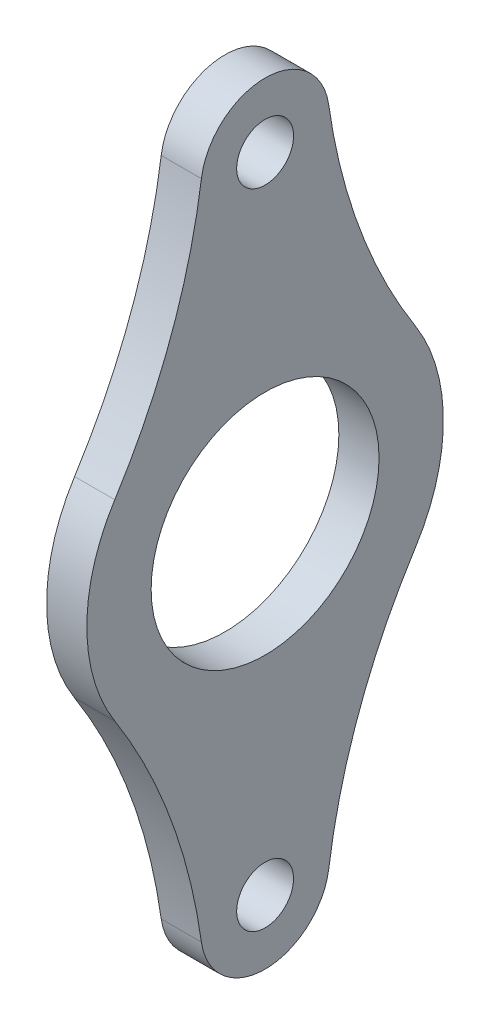
from build123d import *

# Parameters (mm, degrees)
SKETCH1_R           = 2.2479
SKETCH1_R_2         = 9.000000034
BOSS_EXTRUDE1_DEPTH = 3.175


with BuildPart() as part:
    # Sketch1 → Boss-Extrude1 (new body)
    with BuildSketch(Plane.ZY.offset(-54.188)):
        with BuildLine():
            ThreePointArc((-11.872772186, 7.568598389), (-14.080000034, 0), (-11.872772186, -7.568598389))
            ThreePointArc((-11.872772186, -7.568598389), (-7.456309271, -16.470429165), (-5.030561789, -26.106999353))
            ThreePointArc((-5.030561789, -26.106999353), (0, -30.48), (5.030561789, -26.106999353))
            ThreePointArc((5.030561789, -26.106999353), (7.456309271, -16.470429165), (11.872772186, -7.568598389))
            ThreePointArc((11.872772186, -7.568598389), (14.080000034, 0), (11.872772186, 7.568598389))
            ThreePointArc((11.872772186, 7.568598389), (7.456309271, 16.470429165), (5.030561789, 26.106999353))
            ThreePointArc((5.030561789, 26.106999353), (0, 30.48), (-5.030561789, 26.106999353))
            ThreePointArc((-5.030561789, 26.106999353), (-7.456309271, 16.470429165), (-11.872772186, 7.568598389))
        make_face()
        with Locations((0, -25.4)):
            Circle(SKETCH1_R, mode=Mode.SUBTRACT)
        with Locations((0, 25.4)):
            Circle(SKETCH1_R, mode=Mode.SUBTRACT)
        Circle(SKETCH1_R_2, mode=Mode.SUBTRACT)
    extrude(amount=BOSS_EXTRUDE1_DEPTH)


solid = part.part
